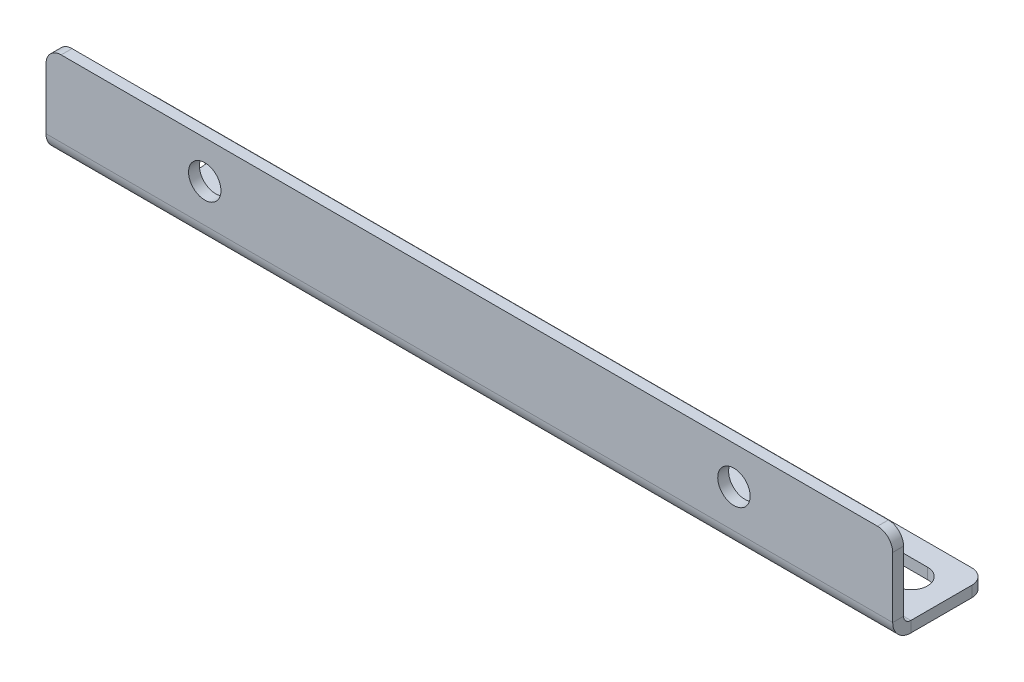
from build123d import *

# Parameters (mm, degrees)
EXTRUDE1_DEPTH             = 88.9
FILLET1_R                  = 3.18
EXTRUDE2_REACH             = 94.271
EXTRUDE3_REACH             = 93.995
SKETCH3_R                  = 3.4036
FLATTEN_BENDS1_START       = -1.524
FLATTEN_BENDS1_OUTLINE_W   = 177.8
FLATTEN_BENDS1_OUTLINE_H   = 5.286
FLATTEN_BENDS1_DEPTH       = 17.4498
FLATTEN_BENDS1_START_2     = -3.81
FLATTEN_BENDS1_2_OUTLINE_R = 3.4036
FLATTEN_BENDS1_2_DEPTH     = 2.286
PROCESS_BENDS1_START       = 2.234903703
PROCESS_BENDS1_OUTLINE_W   = 177.8
PROCESS_BENDS1_OUTLINE_H   = 2.286
PROCESS_BENDS1_DEPTH       = 16.356210101
PROCESS_BENDS1_2_OUTLINE_R = 3.4036
PROCESS_BENDS1_2_DEPTH     = 1.8835878
PROCESS_BENDS1_START_2     = 2.04455268
PROCESS_BENDS1_3_OUTLINE_W = 177.8
PROCESS_BENDS1_3_OUTLINE_H = 2.286
PROCESS_BENDS1_3_DEPTH     = 0.190351023
PROCESS_BENDS1_START_3     = -1.524
PROCESS_BENDS1_4_OUTLINE_R = 3.4036
PROCESS_BENDS1_4_DEPTH     = 3.81
PROCESS_BENDS1_START_4     = -88.9
PROCESS_BENDS1_5_DEPTH     = 177.8


with BuildPart() as part:
    # Sketch1 → Extrude1 (new, symmetric)
    with BuildSketch(Plane(origin=(0, 0, 0), x_dir=(0, 0, -1), z_dir=(1, 0, 0))):
        with BuildLine():
            Line((17.5006, -3.81), (17.5006, -1.524))
            Line((17.5006, -1.524), (1.524, -1.524))
            ThreePointArc((1.524, -1.524), (0.446369265, -1.077630735), (0, 0))
            Line((0, 0), (0, 15.9258))
            Line((0, 15.9258), (-2.286, 15.9258))
            Line((-2.286, 15.9258), (-2.286, 0))
            ThreePointArc((-2.286, 0), (-1.170076836, -2.694076836), (1.524, -3.81))
            Line((1.524, -3.81), (17.5006, -3.81))
        make_face()
    extrude(amount=EXTRUDE1_DEPTH, both=True)

    # Fillet1
    fillet1_edges = [part.edges().sort_by_distance(p)[0] for p in [
        (-88.9, -2.667, -17.5006),
        (88.9, 15.9258, 1.143),
        (88.9, -2.667, -17.5006),
        (-88.9, 15.9258, 1.143),
    ]]
    fillet(fillet1_edges, radius=FILLET1_R)

    # Sketch2 → Extrude2 (cut, up to next)
    with BuildSketch(Plane(origin=(0, -1.524, 0), x_dir=(1, 0, 0), z_dir=(0, 1, 0)), mode=Mode.PRIVATE) as extrude2_sk1:
        with BuildLine():
            Line((80.9625, 12.9667), (71.4375, 12.9667))
            ThreePointArc((71.4375, 12.9667), (68.0339, 9.5631), (71.4375, 6.1595))
            Line((71.4375, 6.1595), (80.9625, 6.1595))
            ThreePointArc((80.9625, 6.1595), (84.3661, 9.5631), (80.9625, 12.9667))
        make_face()
    extrude2_tool1 = extrude(extrude2_sk1.sketch, amount=-EXTRUDE2_REACH, mode=Mode.PRIVATE) & part.part
    # Sketch2 → Extrude2 (cut, up to next)
    with BuildSketch(Plane(origin=(0, -1.524, 0), x_dir=(1, 0, 0), z_dir=(0, 1, 0)), mode=Mode.PRIVATE) as extrude2_sk2:
        with BuildLine():
            Line((-71.4375, 6.1595), (-80.9625, 6.1595))
            ThreePointArc((-80.9625, 6.1595), (-84.3661, 9.5631), (-80.9625, 12.9667))
            Line((-80.9625, 12.9667), (-71.4375, 12.9667))
            ThreePointArc((-71.4375, 12.9667), (-68.0339, 9.5631), (-71.4375, 6.1595))
        make_face()
    extrude2_tool2 = extrude(extrude2_sk2.sketch, amount=-EXTRUDE2_REACH, mode=Mode.PRIVATE) & part.part
    add(extrude2_tool1.solids().sort_by_distance((76.2, -1.524, -9.5631))[0], mode=Mode.SUBTRACT)
    add(extrude2_tool2.solids().sort_by_distance((-76.2, -1.524, -9.5631))[0], mode=Mode.SUBTRACT)

    # Sketch3 → Extrude3 (cut, up to next)
    with BuildSketch(Plane(origin=(0, 0, 0), x_dir=(-1, 0, 0), z_dir=(0, 0, -1)), mode=Mode.PRIVATE) as extrude3_sk1:
        with Locations(Location((-55.5625, 8.001, 0), (0, 0, 90))):
            Circle(SKETCH3_R)
    extrude3_tool1 = extrude(extrude3_sk1.sketch, amount=-EXTRUDE3_REACH, mode=Mode.PRIVATE) & part.part
    # Sketch3 → Extrude3 (cut, up to next)
    with BuildSketch(Plane(origin=(0, 0, 0), x_dir=(-1, 0, 0), z_dir=(0, 0, -1)), mode=Mode.PRIVATE) as extrude3_sk2:
        with Locations(Location((55.5625, 8.001, 0), (0, 0, 90))):
            Circle(SKETCH3_R)
    extrude3_tool2 = extrude(extrude3_sk2.sketch, amount=-EXTRUDE3_REACH, mode=Mode.PRIVATE) & part.part
    add(extrude3_tool1.solids().sort_by_distance((55.5625, 8.001, 0))[0], mode=Mode.SUBTRACT)
    add(extrude3_tool2.solids().sort_by_distance((-55.5625, 8.001, 0))[0], mode=Mode.SUBTRACT)

    # Flatten-Bends1: read off the stored shape, not the designer's step
    # Flatten-Bends1 outline → Flatten-Bends1 (cut)
    with BuildSketch(Plane(origin=(0, 0, 0), x_dir=(1, 0, 0), z_dir=(0, 1, 0)).offset(FLATTEN_BENDS1_START)):
        with Locations((0, 0.357)):
            Rectangle(FLATTEN_BENDS1_OUTLINE_W, FLATTEN_BENDS1_OUTLINE_H)
    extrude(amount=FLATTEN_BENDS1_DEPTH, mode=Mode.SUBTRACT)

    # Flatten-Bends1 2 outline → Flatten-Bends1 2 (add)
    with BuildSketch(Plane(origin=(0, 0, 0), x_dir=(1, 0, 0), z_dir=(0, 1, 0)).offset(FLATTEN_BENDS1_START_2)):
        with BuildLine():
            ThreePointArc((-88.9, -15.411113804), (-87.968599564, -17.659713368), (-85.72, -18.591113804))
            Line((-85.72, -18.591113804), (85.72, -18.591113804))
            ThreePointArc((85.72, -18.591113804), (87.968599564, -17.659713368), (88.9, -15.411113804))
            Line((88.9, -15.411113804), (88.9, 3))
            Line((88.9, 3), (-88.9, 3))
            Line((-88.9, 3), (-88.9, -15.411113804))
        make_face()
        with Locations((-55.5625, -10.666313804)):
            Circle(FLATTEN_BENDS1_2_OUTLINE_R, mode=Mode.SUBTRACT)
        with Locations((55.5625, -10.666313804)):
            Circle(FLATTEN_BENDS1_2_OUTLINE_R, mode=Mode.SUBTRACT)
    extrude(amount=FLATTEN_BENDS1_2_DEPTH)

    # Process-Bends1: read off the stored shape, not the designer's step
    # Process-Bends1 outline → Process-Bends1 (cut)
    with BuildSketch(Plane.XY.offset(PROCESS_BENDS1_START)):
        with Locations((0, -2.667)):
            Rectangle(PROCESS_BENDS1_OUTLINE_W, PROCESS_BENDS1_OUTLINE_H)
    extrude(amount=PROCESS_BENDS1_DEPTH, mode=Mode.SUBTRACT)

    # Process-Bends1 2 outline → Process-Bends1 2 (add)
    with BuildSketch(Plane.XY):
        with BuildLine():
            Line((-88.9, 12.7458), (-88.9, -1.524))
            Line((-88.9, -1.524), (88.9, -1.524))
            Line((88.9, -1.524), (88.9, 12.7458))
            ThreePointArc((88.9, 12.7458), (87.968599564, 14.994399564), (85.72, 15.9258))
            Line((85.72, 15.9258), (-85.72, 15.9258))
            ThreePointArc((-85.72, 15.9258), (-87.968599564, 14.994399564), (-88.9, 12.7458))
        make_face()
        with Locations((-55.5625, 8.001)):
            Circle(PROCESS_BENDS1_2_OUTLINE_R, mode=Mode.SUBTRACT)
        with Locations((55.5625, 8.001)):
            Circle(PROCESS_BENDS1_2_OUTLINE_R, mode=Mode.SUBTRACT)
    extrude(amount=PROCESS_BENDS1_2_DEPTH)

    # Process-Bends1 3 outline → Process-Bends1 3 (cut)
    with BuildSketch(Plane.XY.offset(PROCESS_BENDS1_START_2)):
        with Locations((0, -2.667)):
            Rectangle(PROCESS_BENDS1_3_OUTLINE_W, PROCESS_BENDS1_3_OUTLINE_H)
    extrude(amount=PROCESS_BENDS1_3_DEPTH, mode=Mode.SUBTRACT)

    # Process-Bends1 4 outline → Process-Bends1 4 (add)
    with BuildSketch(Plane.XY.offset(PROCESS_BENDS1_START_3)):
        with BuildLine():
            Line((-88.9, 12.7458), (-88.9, -1.524))
            Line((-88.9, -1.524), (88.9, -1.524))
            Line((88.9, -1.524), (88.9, 12.7458))
            ThreePointArc((88.9, 12.7458), (87.968599564, 14.994399564), (85.72, 15.9258))
            Line((85.72, 15.9258), (-85.72, 15.9258))
            ThreePointArc((-85.72, 15.9258), (-87.968599564, 14.994399564), (-88.9, 12.7458))
        make_face()
        with Locations((-55.5625, 8.001)):
            Circle(PROCESS_BENDS1_4_OUTLINE_R, mode=Mode.SUBTRACT)
        with Locations((55.5625, 8.001)):
            Circle(PROCESS_BENDS1_4_OUTLINE_R, mode=Mode.SUBTRACT)
    extrude(amount=PROCESS_BENDS1_4_DEPTH)

    # Process-Bends1 5 outline → Process-Bends1 5 (cut)
    with BuildSketch(Plane.YZ.offset(PROCESS_BENDS1_START_4)):
        with BuildLine():
            Line((15.9258, -1.524), (15.9258, 0))
            Line((15.9258, 0), (0, 0))
            ThreePointArc((0, 0), (-1.077630735, -0.446369265), (-1.524, -1.524))
            Line((-1.524, -1.524), (15.9258, -1.524))
        make_face()
        with BuildLine():
            ThreePointArc((-3.81, -1.524), (-2.694076836, 1.170076836), (0, 2.286))
            Line((0, 2.286), (-1.524, 2.286))
            Line((-1.524, 2.286), (-1.524, 2.04455268))
            Line((-1.524, 2.04455268), (-3.81, 2.04455268))
            Line((-3.81, 2.04455268), (-3.81, -1.524))
        make_face()
    extrude(amount=PROCESS_BENDS1_5_DEPTH, mode=Mode.SUBTRACT)


solid = part.part
